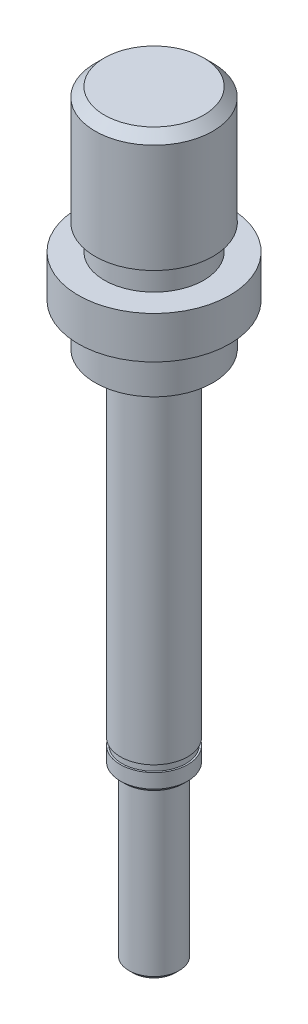
from build123d import *

# Parameters (mm, degrees)
CROQUIS1_W    = 2
CROQUIS1_H    = 5
CHAFL_N2_SIZE = 0.5


# Read off the part's stored shape, not the designer's step: M14 Roscas Standard Taladro1
with BuildPart() as part:
    # Croquis1 → Revolución1 (revolve)
    with BuildSketch(Plane.XY):
        Polygon((0, 90), (0, 0), (2.998, 0), (2.998, 20), (3.998, 20), (3.998, 22.2), (3.8, 22.2), (3.8, 23), (3.998, 23), (3.998, 63), (7, 63), (7, 68), (7, 73), (5.9, 73), (5.9, 76), (7, 76), (7, 90), align=None)
        with Locations((8, 70.5)):
            Rectangle(CROQUIS1_W, CROQUIS1_H)
    revolve(axis=Axis((0, 0, 0), (0, 1, 0)))

    # M14 Roscas Standard Taladro1 outline → M14 Roscas Standard Taladro1 (revolve, cut)
    with BuildSketch(Plane.XY):
        Polygon((7, 90), (5.8985, 90), (7, 88.8985), align=None)
    revolve(axis=Axis((0, 0, 0), (0, 1, 0)), mode=Mode.SUBTRACT)

    # Chaflán2
    chafl_n2_edges = [part.edges().sort_by_distance(p)[0] for p in [
        (-3.998, 20, 0),
        (-2.998, 0, 0),
    ]]
    chamfer(chafl_n2_edges, length=CHAFL_N2_SIZE)


solid = part.part
